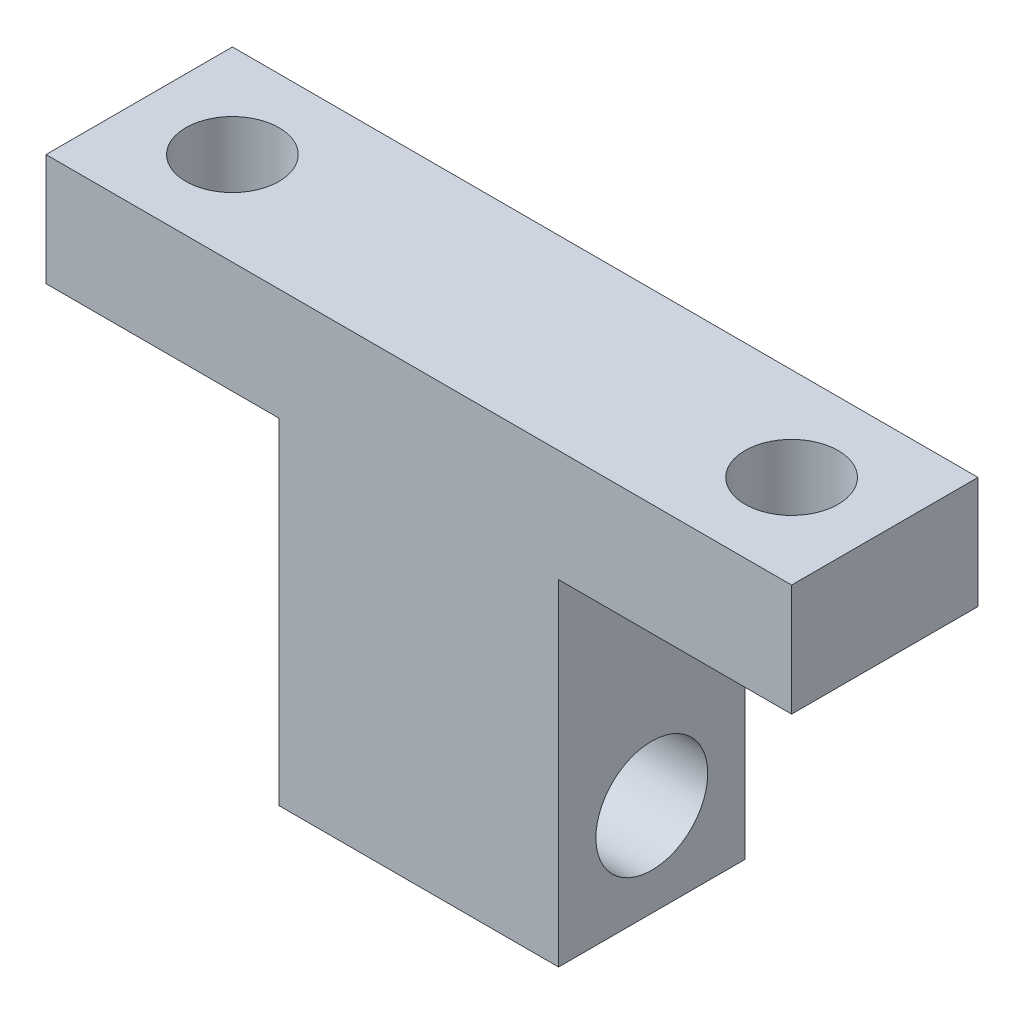
from build123d import *

# Parameters (mm, degrees)
EXTRUDE_1_DEPTH     = 10
SKETCH_2_R          = 2.5
CUT_EXTRUDE_1_DEPTH = 29.705400189
SKETCH_3_R          = 3
CUT_EXTRUDE_2_DEPTH = 38.84507894


with BuildPart() as part:
    # 草图1 → 凸台-拉伸1 (new body)
    with BuildSketch(Plane.XY):
        Polygon((-20, 0), (20, 0), (20, -6), (7.5, -6), (7.5, -24), (-7.5, -24), (-7.5, -6), (-20, -6), align=None)
    extrude(amount=EXTRUDE_1_DEPTH)

    # 草图2 → 切除-拉伸1 (cut, through all)
    with BuildSketch(Plane.XZ.offset(6)):
        with Locations((15, 5)):
            Circle(SKETCH_2_R)
    cut_extrude_1 = extrude(amount=-CUT_EXTRUDE_1_DEPTH, mode=Mode.SUBTRACT)

    # 镜向1: 切除-拉伸1 across plane
    add(cut_extrude_1.mirror(Plane(origin=(0, 0, 0), x_dir=(0, 0, 1), z_dir=(1, 0, 0))), mode=Mode.SUBTRACT)

    # 草图3 → 切除-拉伸2 (cut, through all)
    with BuildSketch(Plane(origin=(7.5, 0, 0), x_dir=(0, 0, -1), z_dir=(1, 0, 0))):
        with Locations((-5, -19)):
            Circle(SKETCH_3_R)
    extrude(amount=-CUT_EXTRUDE_2_DEPTH, mode=Mode.SUBTRACT)


solid = part.part
